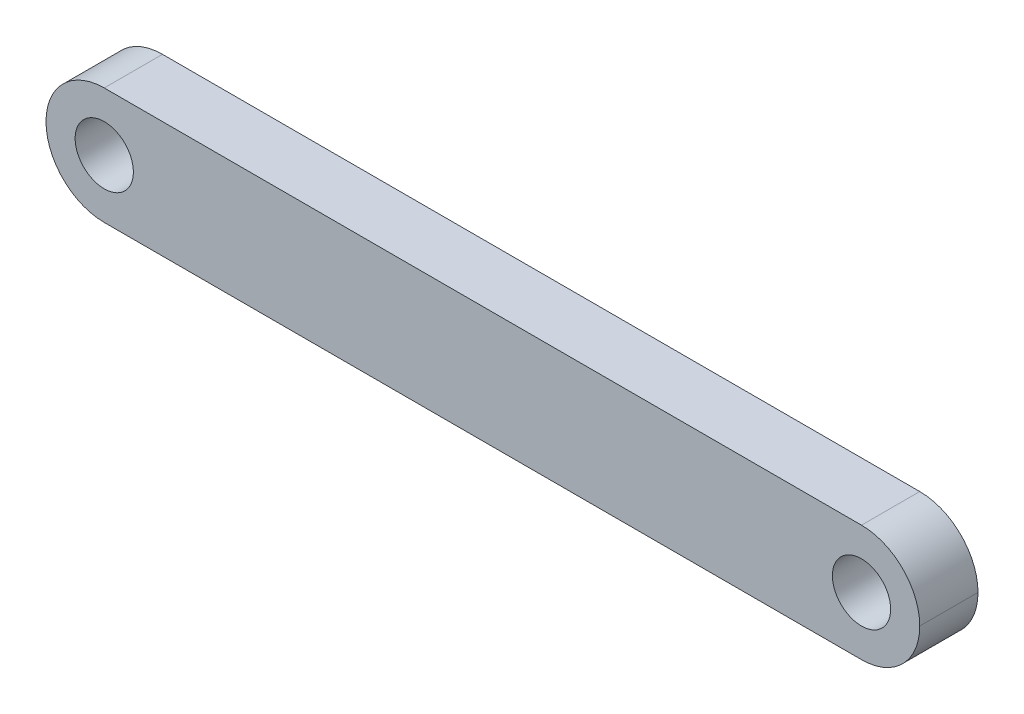
from build123d import *

# Parameters (mm, degrees)
SKETCH1_W           = 150
SKETCH1_H           = 20
BOSS_EXTRUDE1_DEPTH = 10
FILLET1_R           = 10
SKETCH2_R           = 5
CUT_EXTRUDE1_DEPTH  = 152.657508881


with BuildPart() as part:
    # Sketch1 → Boss-Extrude1 (new body)
    with BuildSketch(Plane.XY):
        with Locations((75, 10)):
            Rectangle(SKETCH1_W, SKETCH1_H)
    extrude(amount=BOSS_EXTRUDE1_DEPTH)

    # Fillet1
    fillet1_edges = [part.edges().sort_by_distance(p)[0] for p in [
        (0, 0, 5),
        (150, 0, 5),
        (150, 20, 5),
        (0, 20, 5),
    ]]
    fillet(fillet1_edges, radius=FILLET1_R - 0.0001)  # a hair under: the kernel refuses the full size

    # Sketch2 → Cut-Extrude1 (cut, through all)
    with BuildSketch(Plane.XY.offset(10)):
        with Locations((10, 10)):
            Circle(SKETCH2_R)
        with Locations((140, 10)):
            Circle(SKETCH2_R)
    extrude(amount=-CUT_EXTRUDE1_DEPTH, mode=Mode.SUBTRACT)


solid = part.part
